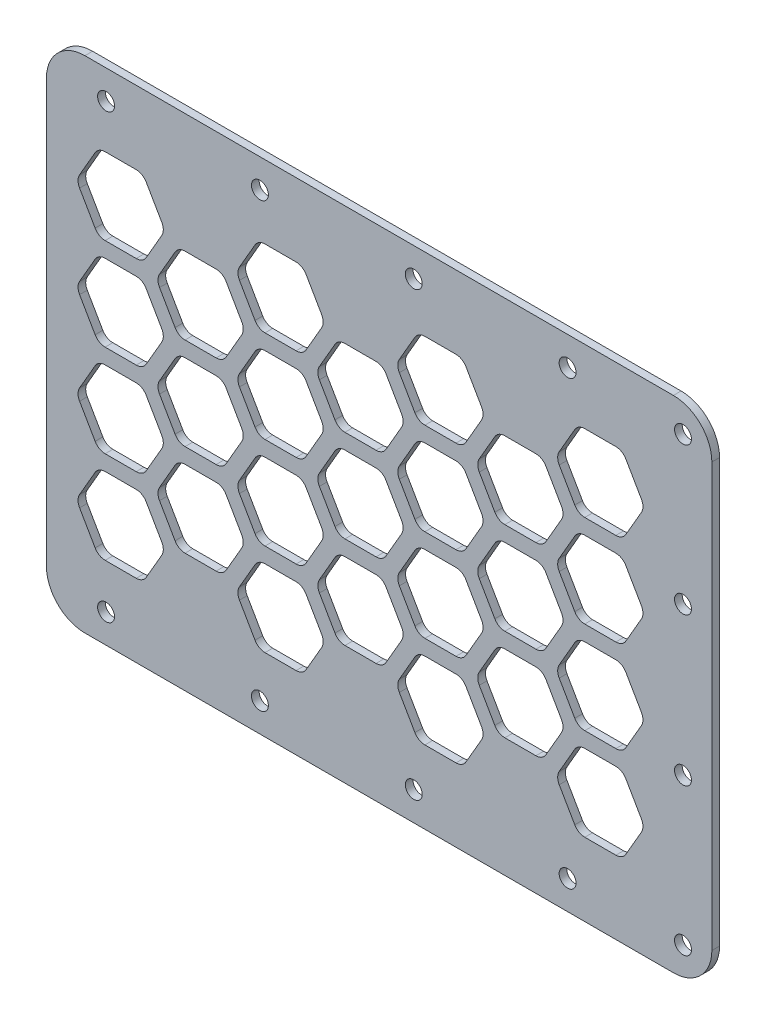
from build123d import *

# Parameters (mm, degrees)
SKETCH_1_W          = 346
SKETCH_1_H          = 130
EXTRUDE_1_DEPTH     = 2
SKETCH_2_R          = 2.2
CUT_EXTRUDE_1_DEPTH = 33
CUT_EXTRUDE_2_DEPTH = 33
FILLET_1_R          = 3
CUT_EXTRUDE_3_DEPTH = 33
FILLET_2_R          = 10
CUT_EXTRUDE_START   = -10
SKETCH_5_R          = 2.2
CUT_EXTRUDE_5_DEPTH = 10
FILLET_4_R          = 10


with BuildPart() as part:
    # 草图1 → 凸台-拉伸1 (new body)
    with BuildSketch(Plane.XY):
        with Locations((173, -65)):
            Rectangle(SKETCH_1_W, SKETCH_1_H)
    extrude(amount=EXTRUDE_1_DEPTH)

    # 草图2 → 切除-拉伸1 (cut)
    with BuildSketch(Plane.XY.offset(2)):
        with Locations((7.502240022, -45.75)):
            Circle(SKETCH_2_R)
        with Locations((7.502240022, -84.25)):
            Circle(SKETCH_2_R)
        with Locations((7.502240022, -122.5)):
            Circle(SKETCH_2_R)
        with Locations((37.502240022, -122.5)):
            Circle(SKETCH_2_R)
        with Locations((77.502240022, -122.5)):
            Circle(SKETCH_2_R)
        with Locations((117.502240022, -122.5)):
            Circle(SKETCH_2_R)
        with Locations((117.502240022, -7.5)):
            Circle(SKETCH_2_R)
        with Locations((77.502240022, -7.5)):
            Circle(SKETCH_2_R)
        with Locations((37.502240022, -7.5)):
            Circle(SKETCH_2_R)
        with Locations((7.502240022, -7.5)):
            Circle(SKETCH_2_R)
        with Locations((308.497759978, -122.5)):
            Circle(SKETCH_2_R)
        with Locations((268.497759978, -122.5)):
            Circle(SKETCH_2_R)
        with Locations((228.497759978, -122.5)):
            Circle(SKETCH_2_R)
        with Locations((228.497759978, -7.5)):
            Circle(SKETCH_2_R)
        with Locations((268.497759978, -7.5)):
            Circle(SKETCH_2_R)
        with Locations((308.497759978, -7.5)):
            Circle(SKETCH_2_R)
        with Locations((338.497759978, -7.5)):
            Circle(SKETCH_2_R)
        with Locations((338.497759978, -45.75)):
            Circle(SKETCH_2_R)
        with Locations((338.497759978, -84.25)):
            Circle(SKETCH_2_R)
        with Locations((338.497759978, -122.5)):
            Circle(SKETCH_2_R)
    extrude(amount=-CUT_EXTRUDE_1_DEPTH, mode=Mode.SUBTRACT)

    # 草图3 → 切除-拉伸2 (cut)
    with BuildSketch(Plane.XY.offset(2)):
        with BuildLine():
            Line((97.993357168, -49.5), (102.900834456, -41))
            Line((102.900834456, -41), (97.127331764, -31))
            Line((97.127331764, -31), (85.580326381, -31))
            Line((85.580326381, -31), (80.672849092, -39.5))
            ThreePointArc((80.672849092, -39.5), (80.270925304, -41), (80.672849092, -42.5))
            Line((80.672849092, -42.5), (85.580326381, -51))
            Line((85.580326381, -51), (95.395280957, -51))
            ThreePointArc((95.395280957, -51), (96.895280957, -50.598076211), (97.993357168, -49.5))
        make_face()
        with BuildLine():
            ThreePointArc((39.68097998, -30.5), (40.082903769, -29), (39.68097998, -27.5))
            Line((39.68097998, -27.5), (34.773502692, -19))
            Line((34.773502692, -19), (24.958548116, -19))
            ThreePointArc((24.958548116, -19), (23.458548116, -19.401923789), (22.360471904, -20.5))
            Line((22.360471904, -20.5), (18.31902002, -27.5))
            ThreePointArc((18.31902002, -27.5), (17.917096231, -29), (18.31902002, -30.5))
            Line((18.31902002, -30.5), (22.360471904, -37.5))
            ThreePointArc((22.360471904, -37.5), (23.458548116, -38.598076211), (24.958548116, -39))
            Line((24.958548116, -39), (33.041451884, -39))
            ThreePointArc((33.041451884, -39), (34.541451884, -38.598076211), (35.639528096, -37.5))
            Line((35.639528096, -37.5), (39.68097998, -30.5))
        make_face()
        with BuildLine():
            ThreePointArc((39.68097998, -54.5), (40.082903769, -53), (39.68097998, -51.5))
            Line((39.68097998, -51.5), (35.639528096, -44.5))
            ThreePointArc((35.639528096, -44.5), (34.541451884, -43.401923789), (33.041451884, -43))
            Line((33.041451884, -43), (24.958548116, -43))
            ThreePointArc((24.958548116, -43), (23.458548116, -43.401923789), (22.360471904, -44.5))
            Line((22.360471904, -44.5), (18.31902002, -51.5))
            ThreePointArc((18.31902002, -51.5), (17.917096231, -53), (18.31902002, -54.5))
            Line((18.31902002, -54.5), (22.360471904, -61.5))
            ThreePointArc((22.360471904, -61.5), (23.458548116, -62.598076211), (24.958548116, -63))
            Line((24.958548116, -63), (33.041451884, -63))
            ThreePointArc((33.041451884, -63), (34.541451884, -62.598076211), (35.639528096, -61.5))
            Line((35.639528096, -61.5), (39.68097998, -54.5))
        make_face()
        with BuildLine():
            ThreePointArc((60.465589671, -42.5), (60.867513459, -41), (60.465589671, -39.5))
            Line((60.465589671, -39.5), (56.424137787, -32.5))
            ThreePointArc((56.424137787, -32.5), (55.326061575, -31.401923789), (53.826061575, -31))
            Line((53.826061575, -31), (45.743157806, -31))
            ThreePointArc((45.743157806, -31), (44.243157806, -31.401923789), (43.145081595, -32.5))
            Line((43.145081595, -32.5), (39.103629711, -39.5))
            ThreePointArc((39.103629711, -39.5), (38.701705922, -41), (39.103629711, -42.5))
            Line((39.103629711, -42.5), (43.145081595, -49.5))
            ThreePointArc((43.145081595, -49.5), (44.243157806, -50.598076211), (45.743157806, -51))
            Line((45.743157806, -51), (53.826061575, -51))
            ThreePointArc((53.826061575, -51), (55.326061575, -50.598076211), (56.424137787, -49.5))
            Line((56.424137787, -49.5), (60.465589671, -42.5))
        make_face()
        with BuildLine():
            ThreePointArc((81.250199362, -30.5), (81.65212315, -29), (81.250199362, -27.5))
            Line((81.250199362, -27.5), (77.208747477, -20.5))
            ThreePointArc((77.208747477, -20.5), (76.110671266, -19.401923789), (74.610671266, -19))
            Line((74.610671266, -19), (66.527767497, -19))
            ThreePointArc((66.527767497, -19), (65.027767497, -19.401923789), (63.929691286, -20.5))
            Line((63.929691286, -20.5), (59.888239402, -27.5))
            ThreePointArc((59.888239402, -27.5), (59.486315613, -29), (59.888239402, -30.5))
            Line((59.888239402, -30.5), (63.929691286, -37.5))
            ThreePointArc((63.929691286, -37.5), (65.027767497, -38.598076211), (66.527767497, -39))
            Line((66.527767497, -39), (74.610671266, -39))
            ThreePointArc((74.610671266, -39), (76.110671266, -38.598076211), (77.208747477, -37.5))
            Line((77.208747477, -37.5), (81.250199362, -30.5))
        make_face()
        with BuildLine():
            ThreePointArc((81.250199362, -54.5), (81.65212315, -53), (81.250199362, -51.5))
            Line((81.250199362, -51.5), (77.208747477, -44.5))
            ThreePointArc((77.208747477, -44.5), (76.110671266, -43.401923789), (74.610671266, -43))
            Line((74.610671266, -43), (66.527767497, -43))
            ThreePointArc((66.527767497, -43), (65.027767497, -43.401923789), (63.929691286, -44.5))
            Line((63.929691286, -44.5), (59.888239402, -51.5))
            ThreePointArc((59.888239402, -51.5), (59.486315613, -53), (59.888239402, -54.5))
            Line((59.888239402, -54.5), (63.929691286, -61.5))
            ThreePointArc((63.929691286, -61.5), (65.027767497, -62.598076211), (66.527767497, -63))
            Line((66.527767497, -63), (74.610671266, -63))
            ThreePointArc((74.610671266, -63), (76.110671266, -62.598076211), (77.208747477, -61.5))
            Line((77.208747477, -61.5), (81.250199362, -54.5))
        make_face()
        with BuildLine():
            ThreePointArc((122.819418743, -30.5), (123.221342532, -29), (122.819418743, -27.5))
            Line((122.819418743, -27.5), (118.777966859, -20.5))
            ThreePointArc((118.777966859, -20.5), (117.679890648, -19.401923789), (116.179890648, -19))
            Line((116.179890648, -19), (108.096986879, -19))
            ThreePointArc((108.096986879, -19), (106.596986879, -19.401923789), (105.498910668, -20.5))
            Line((105.498910668, -20.5), (101.457458783, -27.5))
            ThreePointArc((101.457458783, -27.5), (101.055534995, -29), (101.457458783, -30.5))
            Line((101.457458783, -30.5), (105.498910668, -37.5))
            ThreePointArc((105.498910668, -37.5), (106.596986879, -38.598076211), (108.096986879, -39))
            Line((108.096986879, -39), (116.179890648, -39))
            ThreePointArc((116.179890648, -39), (117.679890648, -38.598076211), (118.777966859, -37.5))
            Line((118.777966859, -37.5), (122.819418743, -30.5))
        make_face()
        with BuildLine():
            ThreePointArc((122.819418743, -54.5), (123.221342532, -53), (122.819418743, -51.5))
            Line((122.819418743, -51.5), (118.777966859, -44.5))
            ThreePointArc((118.777966859, -44.5), (117.679890648, -43.401923789), (116.179890648, -43))
            Line((116.179890648, -43), (108.096986879, -43))
            ThreePointArc((108.096986879, -43), (106.596986879, -43.401923789), (105.498910668, -44.5))
            Line((105.498910668, -44.5), (101.457458783, -51.5))
            ThreePointArc((101.457458783, -51.5), (101.055534995, -53), (101.457458783, -54.5))
            Line((101.457458783, -54.5), (105.498910668, -61.5))
            ThreePointArc((105.498910668, -61.5), (106.596986879, -62.598076211), (108.096986879, -63))
            Line((108.096986879, -63), (116.179890648, -63))
            ThreePointArc((116.179890648, -63), (117.679890648, -62.598076211), (118.777966859, -61.5))
            Line((118.777966859, -61.5), (122.819418743, -54.5))
        make_face()
        with BuildLine():
            Line((138.696551146, -51), (144.470053838, -41))
            Line((144.470053838, -41), (139.56257655, -32.5))
            ThreePointArc((139.56257655, -32.5), (138.464500338, -31.401923789), (136.964500338, -31))
            Line((136.964500338, -31), (127.149545762, -31))
            Line((127.149545762, -31), (121.37604307, -41))
            Line((121.37604307, -41), (126.283520358, -49.5))
            ThreePointArc((126.283520358, -49.5), (127.38159657, -50.598076211), (128.88159657, -51))
            Line((128.88159657, -51), (138.696551146, -51))
        make_face()
        with BuildLine():
            ThreePointArc((164.388638125, -30.5), (164.790561914, -29), (164.388638125, -27.5))
            Line((164.388638125, -27.5), (160.347186241, -20.5))
            ThreePointArc((160.347186241, -20.5), (159.249110029, -19.401923789), (157.749110029, -19))
            Line((157.749110029, -19), (149.666206261, -19))
            ThreePointArc((149.666206261, -19), (148.166206261, -19.401923789), (147.068130049, -20.5))
            Line((147.068130049, -20.5), (143.026678165, -27.5))
            ThreePointArc((143.026678165, -27.5), (142.624754376, -29), (143.026678165, -30.5))
            Line((143.026678165, -30.5), (147.068130049, -37.5))
            ThreePointArc((147.068130049, -37.5), (148.166206261, -38.598076211), (149.666206261, -39))
            Line((149.666206261, -39), (157.749110029, -39))
            ThreePointArc((157.749110029, -39), (159.249110029, -38.598076211), (160.347186241, -37.5))
            Line((160.347186241, -37.5), (164.388638125, -30.5))
        make_face()
        with BuildLine():
            ThreePointArc((164.388638125, -54.5), (164.790561914, -53), (164.388638125, -51.5))
            Line((164.388638125, -51.5), (160.347186241, -44.5))
            ThreePointArc((160.347186241, -44.5), (159.249110029, -43.401923789), (157.749110029, -43))
            Line((157.749110029, -43), (149.666206261, -43))
            ThreePointArc((149.666206261, -43), (148.166206261, -43.401923789), (147.068130049, -44.5))
            Line((147.068130049, -44.5), (143.026678165, -51.5))
            ThreePointArc((143.026678165, -51.5), (142.624754376, -53), (143.026678165, -54.5))
            Line((143.026678165, -54.5), (147.068130049, -61.5))
            ThreePointArc((147.068130049, -61.5), (148.166206261, -62.598076211), (149.666206261, -63))
            Line((149.666206261, -63), (157.749110029, -63))
            ThreePointArc((157.749110029, -63), (159.249110029, -62.598076211), (160.347186241, -61.5))
            Line((160.347186241, -61.5), (164.388638125, -54.5))
        make_face()
        with BuildLine():
            Line((181.611361875, -54.5), (185.652813759, -61.5))
            ThreePointArc((185.652813759, -61.5), (186.750889971, -62.598076211), (188.250889971, -63))
            Line((188.250889971, -63), (196.333793739, -63))
            ThreePointArc((196.333793739, -63), (197.833793739, -62.598076211), (198.931869951, -61.5))
            Line((198.931869951, -61.5), (202.973321835, -54.5))
            ThreePointArc((202.973321835, -54.5), (203.375245624, -53), (202.973321835, -51.5))
            Line((202.973321835, -51.5), (198.931869951, -44.5))
            ThreePointArc((198.931869951, -44.5), (197.833793739, -43.401923789), (196.333793739, -43))
            Line((196.333793739, -43), (188.250889971, -43))
            ThreePointArc((188.250889971, -43), (186.750889971, -43.401923789), (185.652813759, -44.5))
            Line((185.652813759, -44.5), (181.611361875, -51.5))
            ThreePointArc((181.611361875, -51.5), (181.209438086, -53), (181.611361875, -54.5))
        make_face()
        with BuildLine():
            Line((181.611361875, -30.5), (185.652813759, -37.5))
            ThreePointArc((185.652813759, -37.5), (186.750889971, -38.598076211), (188.250889971, -39))
            Line((188.250889971, -39), (196.333793739, -39))
            ThreePointArc((196.333793739, -39), (197.833793739, -38.598076211), (198.931869951, -37.5))
            Line((198.931869951, -37.5), (202.973321835, -30.5))
            ThreePointArc((202.973321835, -30.5), (203.375245624, -29), (202.973321835, -27.5))
            Line((202.973321835, -27.5), (198.931869951, -20.5))
            ThreePointArc((198.931869951, -20.5), (197.833793739, -19.401923789), (196.333793739, -19))
            Line((196.333793739, -19), (188.250889971, -19))
            ThreePointArc((188.250889971, -19), (186.750889971, -19.401923789), (185.652813759, -20.5))
            Line((185.652813759, -20.5), (181.611361875, -27.5))
            ThreePointArc((181.611361875, -27.5), (181.209438086, -29), (181.611361875, -30.5))
        make_face()
        with BuildLine():
            Line((202.395971566, -42.5), (206.43742345, -49.5))
            ThreePointArc((206.43742345, -49.5), (207.535499662, -50.598076211), (209.035499662, -51))
            Line((209.035499662, -51), (217.11840343, -51))
            ThreePointArc((217.11840343, -51), (218.61840343, -50.598076211), (219.716479642, -49.5))
            Line((219.716479642, -49.5), (223.757931526, -42.5))
            ThreePointArc((223.757931526, -42.5), (224.159855315, -41), (223.757931526, -39.5))
            Line((223.757931526, -39.5), (219.716479642, -32.5))
            ThreePointArc((219.716479642, -32.5), (218.61840343, -31.401923789), (217.11840343, -31))
            Line((217.11840343, -31), (209.035499662, -31))
            ThreePointArc((209.035499662, -31), (207.535499662, -31.401923789), (206.43742345, -32.5))
            Line((206.43742345, -32.5), (202.395971566, -39.5))
            ThreePointArc((202.395971566, -39.5), (201.994047777, -41), (202.395971566, -42.5))
        make_face()
        with BuildLine():
            Line((223.180581257, -54.5), (227.222033141, -61.5))
            ThreePointArc((227.222033141, -61.5), (228.320109352, -62.598076211), (229.820109352, -63))
            Line((229.820109352, -63), (237.903013121, -63))
            ThreePointArc((237.903013121, -63), (239.403013121, -62.598076211), (240.501089332, -61.5))
            Line((240.501089332, -61.5), (244.542541217, -54.5))
            ThreePointArc((244.542541217, -54.5), (244.944465005, -53), (244.542541217, -51.5))
            Line((244.542541217, -51.5), (240.501089332, -44.5))
            ThreePointArc((240.501089332, -44.5), (239.403013121, -43.401923789), (237.903013121, -43))
            Line((237.903013121, -43), (229.820109352, -43))
            ThreePointArc((229.820109352, -43), (228.320109352, -43.401923789), (227.222033141, -44.5))
            Line((227.222033141, -44.5), (223.180581257, -51.5))
            ThreePointArc((223.180581257, -51.5), (222.778657468, -53), (223.180581257, -54.5))
        make_face()
        with BuildLine():
            Line((223.180581257, -30.5), (227.222033141, -37.5))
            ThreePointArc((227.222033141, -37.5), (228.320109352, -38.598076211), (229.820109352, -39))
            Line((229.820109352, -39), (237.903013121, -39))
            ThreePointArc((237.903013121, -39), (239.403013121, -38.598076211), (240.501089332, -37.5))
            Line((240.501089332, -37.5), (244.542541217, -30.5))
            ThreePointArc((244.542541217, -30.5), (244.944465005, -29), (244.542541217, -27.5))
            Line((244.542541217, -27.5), (240.501089332, -20.5))
            ThreePointArc((240.501089332, -20.5), (239.403013121, -19.401923789), (237.903013121, -19))
            Line((237.903013121, -19), (229.820109352, -19))
            ThreePointArc((229.820109352, -19), (228.320109352, -19.401923789), (227.222033141, -20.5))
            Line((227.222033141, -20.5), (223.180581257, -27.5))
            ThreePointArc((223.180581257, -27.5), (222.778657468, -29), (223.180581257, -30.5))
        make_face()
        with BuildLine():
            Line((243.965190948, -42.5), (248.006642832, -49.5))
            ThreePointArc((248.006642832, -49.5), (249.104719043, -50.598076211), (250.604719043, -51))
            Line((250.604719043, -51), (258.687622812, -51))
            ThreePointArc((258.687622812, -51), (260.187622812, -50.598076211), (261.285699023, -49.5))
            Line((261.285699023, -49.5), (265.327150908, -42.5))
            ThreePointArc((265.327150908, -42.5), (265.729074696, -41), (265.327150908, -39.5))
            Line((265.327150908, -39.5), (261.285699023, -32.5))
            ThreePointArc((261.285699023, -32.5), (260.187622812, -31.401923789), (258.687622812, -31))
            Line((258.687622812, -31), (250.604719043, -31))
            ThreePointArc((250.604719043, -31), (249.104719043, -31.401923789), (248.006642832, -32.5))
            Line((248.006642832, -32.5), (243.965190948, -39.5))
            ThreePointArc((243.965190948, -39.5), (243.563267159, -41), (243.965190948, -42.5))
        make_face()
        with BuildLine():
            Line((264.749800638, -30.5), (268.791252523, -37.5))
            ThreePointArc((268.791252523, -37.5), (269.889328734, -38.598076211), (271.389328734, -39))
            Line((271.389328734, -39), (279.472232503, -39))
            ThreePointArc((279.472232503, -39), (280.972232503, -38.598076211), (282.070308714, -37.5))
            Line((282.070308714, -37.5), (286.111760598, -30.5))
            ThreePointArc((286.111760598, -30.5), (286.513684387, -29), (286.111760598, -27.5))
            Line((286.111760598, -27.5), (282.070308714, -20.5))
            ThreePointArc((282.070308714, -20.5), (280.972232503, -19.401923789), (279.472232503, -19))
            Line((279.472232503, -19), (271.389328734, -19))
            ThreePointArc((271.389328734, -19), (269.889328734, -19.401923789), (268.791252523, -20.5))
            Line((268.791252523, -20.5), (264.749800638, -27.5))
            ThreePointArc((264.749800638, -27.5), (264.34787685, -29), (264.749800638, -30.5))
        make_face()
        with BuildLine():
            Line((264.749800638, -54.5), (268.791252523, -61.5))
            ThreePointArc((268.791252523, -61.5), (269.889328734, -62.598076211), (271.389328734, -63))
            Line((271.389328734, -63), (279.472232503, -63))
            ThreePointArc((279.472232503, -63), (280.972232503, -62.598076211), (282.070308714, -61.5))
            Line((282.070308714, -61.5), (286.111760598, -54.5))
            ThreePointArc((286.111760598, -54.5), (286.513684387, -53), (286.111760598, -51.5))
            Line((286.111760598, -51.5), (282.070308714, -44.5))
            ThreePointArc((282.070308714, -44.5), (280.972232503, -43.401923789), (279.472232503, -43))
            Line((279.472232503, -43), (271.389328734, -43))
            ThreePointArc((271.389328734, -43), (269.889328734, -43.401923789), (268.791252523, -44.5))
            Line((268.791252523, -44.5), (264.749800638, -51.5))
            ThreePointArc((264.749800638, -51.5), (264.34787685, -53), (264.749800638, -54.5))
        make_face()
        with BuildLine():
            Line((285.534410329, -42.5), (289.575862213, -49.5))
            ThreePointArc((289.575862213, -49.5), (290.673938425, -50.598076211), (292.173938425, -51))
            Line((292.173938425, -51), (300.256842194, -51))
            ThreePointArc((300.256842194, -51), (301.756842194, -50.598076211), (302.854918405, -49.5))
            Line((302.854918405, -49.5), (306.896370289, -42.5))
            ThreePointArc((306.896370289, -42.5), (307.298294078, -41), (306.896370289, -39.5))
            Line((306.896370289, -39.5), (302.854918405, -32.5))
            ThreePointArc((302.854918405, -32.5), (301.756842194, -31.401923789), (300.256842194, -31))
            Line((300.256842194, -31), (292.173938425, -31))
            ThreePointArc((292.173938425, -31), (290.673938425, -31.401923789), (289.575862213, -32.5))
            Line((289.575862213, -32.5), (285.534410329, -39.5))
            ThreePointArc((285.534410329, -39.5), (285.132486541, -41), (285.534410329, -42.5))
        make_face()
        with BuildLine():
            Line((306.31902002, -54.5), (310.360471904, -61.5))
            ThreePointArc((310.360471904, -61.5), (311.458548116, -62.598076211), (312.958548116, -63))
            Line((312.958548116, -63), (321.041451884, -63))
            ThreePointArc((321.041451884, -63), (322.541451884, -62.598076211), (323.639528096, -61.5))
            Line((323.639528096, -61.5), (327.68097998, -54.5))
            ThreePointArc((327.68097998, -54.5), (328.082903769, -53), (327.68097998, -51.5))
            Line((327.68097998, -51.5), (323.639528096, -44.5))
            ThreePointArc((323.639528096, -44.5), (322.541451884, -43.401923789), (321.041451884, -43))
            Line((321.041451884, -43), (312.958548116, -43))
            ThreePointArc((312.958548116, -43), (311.458548116, -43.401923789), (310.360471904, -44.5))
            Line((310.360471904, -44.5), (306.31902002, -51.5))
            ThreePointArc((306.31902002, -51.5), (305.917096231, -53), (306.31902002, -54.5))
        make_face()
        with BuildLine():
            Line((306.31902002, -30.5), (310.360471904, -37.5))
            ThreePointArc((310.360471904, -37.5), (311.458548116, -38.598076211), (312.958548116, -39))
            Line((312.958548116, -39), (321.041451884, -39))
            ThreePointArc((321.041451884, -39), (322.541451884, -38.598076211), (323.639528096, -37.5))
            Line((323.639528096, -37.5), (327.68097998, -30.5))
            ThreePointArc((327.68097998, -30.5), (328.082903769, -29), (327.68097998, -27.5))
            Line((327.68097998, -27.5), (323.639528096, -20.5))
            ThreePointArc((323.639528096, -20.5), (322.541451884, -19.401923789), (321.041451884, -19))
            Line((321.041451884, -19), (312.958548116, -19))
            ThreePointArc((312.958548116, -19), (311.458548116, -19.401923789), (310.360471904, -20.5))
            Line((310.360471904, -20.5), (306.31902002, -27.5))
            ThreePointArc((306.31902002, -27.5), (305.917096231, -29), (306.31902002, -30.5))
        make_face()
        with BuildLine():
            ThreePointArc((323.639528096, -92.5), (322.541451884, -91.401923789), (321.041451884, -91))
            Line((321.041451884, -91), (312.958548116, -91))
            ThreePointArc((312.958548116, -91), (311.458548116, -91.401923789), (310.360471904, -92.5))
            Line((310.360471904, -92.5), (306.31902002, -99.5))
            ThreePointArc((306.31902002, -99.5), (305.917096231, -101), (306.31902002, -102.5))
            Line((306.31902002, -102.5), (310.360471904, -109.5))
            ThreePointArc((310.360471904, -109.5), (311.458548116, -110.598076211), (312.958548116, -111))
            Line((312.958548116, -111), (321.041451884, -111))
            ThreePointArc((321.041451884, -111), (322.541451884, -110.598076211), (323.639528096, -109.5))
            Line((323.639528096, -109.5), (327.68097998, -102.5))
            ThreePointArc((327.68097998, -102.5), (328.082903769, -101), (327.68097998, -99.5))
            Line((327.68097998, -99.5), (323.639528096, -92.5))
        make_face()
        with BuildLine():
            ThreePointArc((323.639528096, -68.5), (322.541451884, -67.401923789), (321.041451884, -67))
            Line((321.041451884, -67), (312.958548116, -67))
            ThreePointArc((312.958548116, -67), (311.458548116, -67.401923789), (310.360471904, -68.5))
            Line((310.360471904, -68.5), (306.31902002, -75.5))
            ThreePointArc((306.31902002, -75.5), (305.917096231, -77), (306.31902002, -78.5))
            Line((306.31902002, -78.5), (310.360471904, -85.5))
            ThreePointArc((310.360471904, -85.5), (311.458548116, -86.598076211), (312.958548116, -87))
            Line((312.958548116, -87), (321.041451884, -87))
            ThreePointArc((321.041451884, -87), (322.541451884, -86.598076211), (323.639528096, -85.5))
            Line((323.639528096, -85.5), (327.68097998, -78.5))
            ThreePointArc((327.68097998, -78.5), (328.082903769, -77), (327.68097998, -75.5))
            Line((327.68097998, -75.5), (323.639528096, -68.5))
        make_face()
        with BuildLine():
            ThreePointArc((302.854918405, -80.5), (301.756842194, -79.401923789), (300.256842194, -79))
            Line((300.256842194, -79), (292.173938425, -79))
            ThreePointArc((292.173938425, -79), (290.673938425, -79.401923789), (289.575862213, -80.5))
            Line((289.575862213, -80.5), (285.534410329, -87.5))
            ThreePointArc((285.534410329, -87.5), (285.132486541, -89), (285.534410329, -90.5))
            Line((285.534410329, -90.5), (289.575862213, -97.5))
            ThreePointArc((289.575862213, -97.5), (290.673938425, -98.598076211), (292.173938425, -99))
            Line((292.173938425, -99), (300.256842194, -99))
            ThreePointArc((300.256842194, -99), (301.756842194, -98.598076211), (302.854918405, -97.5))
            Line((302.854918405, -97.5), (306.896370289, -90.5))
            ThreePointArc((306.896370289, -90.5), (307.298294078, -89), (306.896370289, -87.5))
            Line((306.896370289, -87.5), (302.854918405, -80.5))
        make_face()
        with BuildLine():
            ThreePointArc((282.070308714, -92.5), (280.972232503, -91.401923789), (279.472232503, -91))
            Line((279.472232503, -91), (271.389328734, -91))
            ThreePointArc((271.389328734, -91), (269.889328734, -91.401923789), (268.791252523, -92.5))
            Line((268.791252523, -92.5), (264.749800638, -99.5))
            ThreePointArc((264.749800638, -99.5), (264.34787685, -101), (264.749800638, -102.5))
            Line((264.749800638, -102.5), (268.791252523, -109.5))
            ThreePointArc((268.791252523, -109.5), (269.889328734, -110.598076211), (271.389328734, -111))
            Line((271.389328734, -111), (279.472232503, -111))
            ThreePointArc((279.472232503, -111), (280.972232503, -110.598076211), (282.070308714, -109.5))
            Line((282.070308714, -109.5), (286.111760598, -102.5))
            ThreePointArc((286.111760598, -102.5), (286.513684387, -101), (286.111760598, -99.5))
            Line((286.111760598, -99.5), (282.070308714, -92.5))
        make_face()
        with BuildLine():
            ThreePointArc((282.070308714, -68.5), (280.972232503, -67.401923789), (279.472232503, -67))
            Line((279.472232503, -67), (271.389328734, -67))
            ThreePointArc((271.389328734, -67), (269.889328734, -67.401923789), (268.791252523, -68.5))
            Line((268.791252523, -68.5), (264.749800638, -75.5))
            ThreePointArc((264.749800638, -75.5), (264.34787685, -77), (264.749800638, -78.5))
            Line((264.749800638, -78.5), (268.791252523, -85.5))
            ThreePointArc((268.791252523, -85.5), (269.889328734, -86.598076211), (271.389328734, -87))
            Line((271.389328734, -87), (279.472232503, -87))
            ThreePointArc((279.472232503, -87), (280.972232503, -86.598076211), (282.070308714, -85.5))
            Line((282.070308714, -85.5), (286.111760598, -78.5))
            ThreePointArc((286.111760598, -78.5), (286.513684387, -77), (286.111760598, -75.5))
            Line((286.111760598, -75.5), (282.070308714, -68.5))
        make_face()
        with BuildLine():
            ThreePointArc((261.285699023, -80.5), (260.187622812, -79.401923789), (258.687622812, -79))
            Line((258.687622812, -79), (250.604719043, -79))
            ThreePointArc((250.604719043, -79), (249.104719043, -79.401923789), (248.006642832, -80.5))
            Line((248.006642832, -80.5), (243.965190948, -87.5))
            ThreePointArc((243.965190948, -87.5), (243.563267159, -89), (243.965190948, -90.5))
            Line((243.965190948, -90.5), (248.006642832, -97.5))
            ThreePointArc((248.006642832, -97.5), (249.104719043, -98.598076211), (250.604719043, -99))
            Line((250.604719043, -99), (258.687622812, -99))
            ThreePointArc((258.687622812, -99), (260.187622812, -98.598076211), (261.285699023, -97.5))
            Line((261.285699023, -97.5), (265.327150908, -90.5))
            ThreePointArc((265.327150908, -90.5), (265.729074696, -89), (265.327150908, -87.5))
            Line((265.327150908, -87.5), (261.285699023, -80.5))
        make_face()
        with BuildLine():
            ThreePointArc((240.501089332, -68.5), (239.403013121, -67.401923789), (237.903013121, -67))
            Line((237.903013121, -67), (229.820109352, -67))
            ThreePointArc((229.820109352, -67), (228.320109352, -67.401923789), (227.222033141, -68.5))
            Line((227.222033141, -68.5), (223.180581257, -75.5))
            ThreePointArc((223.180581257, -75.5), (222.778657468, -77), (223.180581257, -78.5))
            Line((223.180581257, -78.5), (227.222033141, -85.5))
            ThreePointArc((227.222033141, -85.5), (228.320109352, -86.598076211), (229.820109352, -87))
            Line((229.820109352, -87), (237.903013121, -87))
            ThreePointArc((237.903013121, -87), (239.403013121, -86.598076211), (240.501089332, -85.5))
            Line((240.501089332, -85.5), (244.542541217, -78.5))
            ThreePointArc((244.542541217, -78.5), (244.944465005, -77), (244.542541217, -75.5))
            Line((244.542541217, -75.5), (240.501089332, -68.5))
        make_face()
        with BuildLine():
            ThreePointArc((240.501089332, -92.5), (239.403013121, -91.401923789), (237.903013121, -91))
            Line((237.903013121, -91), (229.820109352, -91))
            ThreePointArc((229.820109352, -91), (228.320109352, -91.401923789), (227.222033141, -92.5))
            Line((227.222033141, -92.5), (223.180581257, -99.5))
            ThreePointArc((223.180581257, -99.5), (222.778657468, -101), (223.180581257, -102.5))
            Line((223.180581257, -102.5), (227.222033141, -109.5))
            ThreePointArc((227.222033141, -109.5), (228.320109352, -110.598076211), (229.820109352, -111))
            Line((229.820109352, -111), (237.903013121, -111))
            ThreePointArc((237.903013121, -111), (239.403013121, -110.598076211), (240.501089332, -109.5))
            Line((240.501089332, -109.5), (244.542541217, -102.5))
            ThreePointArc((244.542541217, -102.5), (244.944465005, -101), (244.542541217, -99.5))
            Line((244.542541217, -99.5), (240.501089332, -92.5))
        make_face()
        with BuildLine():
            ThreePointArc((219.716479642, -80.5), (218.61840343, -79.401923789), (217.11840343, -79))
            Line((217.11840343, -79), (209.035499662, -79))
            ThreePointArc((209.035499662, -79), (207.535499662, -79.401923789), (206.43742345, -80.5))
            Line((206.43742345, -80.5), (202.395971566, -87.5))
            ThreePointArc((202.395971566, -87.5), (201.994047777, -89), (202.395971566, -90.5))
            Line((202.395971566, -90.5), (206.43742345, -97.5))
            ThreePointArc((206.43742345, -97.5), (207.535499662, -98.598076211), (209.035499662, -99))
            Line((209.035499662, -99), (217.11840343, -99))
            ThreePointArc((217.11840343, -99), (218.61840343, -98.598076211), (219.716479642, -97.5))
            Line((219.716479642, -97.5), (223.757931526, -90.5))
            ThreePointArc((223.757931526, -90.5), (224.159855315, -89), (223.757931526, -87.5))
            Line((223.757931526, -87.5), (219.716479642, -80.5))
        make_face()
        with BuildLine():
            ThreePointArc((198.931869951, -68.5), (197.833793739, -67.401923789), (196.333793739, -67))
            Line((196.333793739, -67), (188.250889971, -67))
            ThreePointArc((188.250889971, -67), (186.750889971, -67.401923789), (185.652813759, -68.5))
            Line((185.652813759, -68.5), (181.611361875, -75.5))
            ThreePointArc((181.611361875, -75.5), (181.209438086, -77), (181.611361875, -78.5))
            Line((181.611361875, -78.5), (185.652813759, -85.5))
            ThreePointArc((185.652813759, -85.5), (186.750889971, -86.598076211), (188.250889971, -87))
            Line((188.250889971, -87), (196.333793739, -87))
            ThreePointArc((196.333793739, -87), (197.833793739, -86.598076211), (198.931869951, -85.5))
            Line((198.931869951, -85.5), (202.973321835, -78.5))
            ThreePointArc((202.973321835, -78.5), (203.375245624, -77), (202.973321835, -75.5))
            Line((202.973321835, -75.5), (198.931869951, -68.5))
        make_face()
        with BuildLine():
            ThreePointArc((198.931869951, -92.5), (197.833793739, -91.401923789), (196.333793739, -91))
            Line((196.333793739, -91), (188.250889971, -91))
            ThreePointArc((188.250889971, -91), (186.750889971, -91.401923789), (185.652813759, -92.5))
            Line((185.652813759, -92.5), (181.611361875, -99.5))
            ThreePointArc((181.611361875, -99.5), (181.209438086, -101), (181.611361875, -102.5))
            Line((181.611361875, -102.5), (185.652813759, -109.5))
            ThreePointArc((185.652813759, -109.5), (186.750889971, -110.598076211), (188.250889971, -111))
            Line((188.250889971, -111), (196.333793739, -111))
            ThreePointArc((196.333793739, -111), (197.833793739, -110.598076211), (198.931869951, -109.5))
            Line((198.931869951, -109.5), (202.973321835, -102.5))
            ThreePointArc((202.973321835, -102.5), (203.375245624, -101), (202.973321835, -99.5))
            Line((202.973321835, -99.5), (198.931869951, -92.5))
        make_face()
        with BuildLine():
            Line((164.388638125, -75.5), (160.347186241, -68.5))
            ThreePointArc((160.347186241, -68.5), (159.249110029, -67.401923789), (157.749110029, -67))
            Line((157.749110029, -67), (149.666206261, -67))
            ThreePointArc((149.666206261, -67), (148.166206261, -67.401923789), (147.068130049, -68.5))
            Line((147.068130049, -68.5), (143.026678165, -75.5))
            ThreePointArc((143.026678165, -75.5), (142.624754376, -77), (143.026678165, -78.5))
            Line((143.026678165, -78.5), (147.068130049, -85.5))
            ThreePointArc((147.068130049, -85.5), (148.166206261, -86.598076211), (149.666206261, -87))
            Line((149.666206261, -87), (157.749110029, -87))
            ThreePointArc((157.749110029, -87), (159.249110029, -86.598076211), (160.347186241, -85.5))
            Line((160.347186241, -85.5), (164.388638125, -78.5))
            ThreePointArc((164.388638125, -78.5), (164.790561914, -77), (164.388638125, -75.5))
        make_face()
        with BuildLine():
            Line((164.388638125, -99.5), (160.347186241, -92.5))
            ThreePointArc((160.347186241, -92.5), (159.249110029, -91.401923789), (157.749110029, -91))
            Line((157.749110029, -91), (149.666206261, -91))
            ThreePointArc((149.666206261, -91), (148.166206261, -91.401923789), (147.068130049, -92.5))
            Line((147.068130049, -92.5), (143.026678165, -99.5))
            ThreePointArc((143.026678165, -99.5), (142.624754376, -101), (143.026678165, -102.5))
            Line((143.026678165, -102.5), (147.068130049, -109.5))
            ThreePointArc((147.068130049, -109.5), (148.166206261, -110.598076211), (149.666206261, -111))
            Line((149.666206261, -111), (157.749110029, -111))
            ThreePointArc((157.749110029, -111), (159.249110029, -110.598076211), (160.347186241, -109.5))
            Line((160.347186241, -109.5), (164.388638125, -102.5))
            ThreePointArc((164.388638125, -102.5), (164.790561914, -101), (164.388638125, -99.5))
        make_face()
        with BuildLine():
            Line((144.470053838, -89), (138.696551146, -79))
            Line((138.696551146, -79), (128.88159657, -79))
            ThreePointArc((128.88159657, -79), (127.38159657, -79.401923789), (126.283520358, -80.5))
            Line((126.283520358, -80.5), (121.37604307, -89))
            Line((121.37604307, -89), (127.149545762, -99))
            Line((127.149545762, -99), (136.964500338, -99))
            ThreePointArc((136.964500338, -99), (138.464500338, -98.598076211), (139.56257655, -97.5))
            Line((139.56257655, -97.5), (144.470053838, -89))
        make_face()
        with BuildLine():
            Line((122.819418743, -75.5), (118.777966859, -68.5))
            ThreePointArc((118.777966859, -68.5), (117.679890648, -67.401923789), (116.179890648, -67))
            Line((116.179890648, -67), (108.096986879, -67))
            ThreePointArc((108.096986879, -67), (106.596986879, -67.401923789), (105.498910668, -68.5))
            Line((105.498910668, -68.5), (101.457458783, -75.5))
            ThreePointArc((101.457458783, -75.5), (101.055534995, -77), (101.457458783, -78.5))
            Line((101.457458783, -78.5), (105.498910668, -85.5))
            ThreePointArc((105.498910668, -85.5), (106.596986879, -86.598076211), (108.096986879, -87))
            Line((108.096986879, -87), (116.179890648, -87))
            ThreePointArc((116.179890648, -87), (117.679890648, -86.598076211), (118.777966859, -85.5))
            Line((118.777966859, -85.5), (122.819418743, -78.5))
            ThreePointArc((122.819418743, -78.5), (123.221342532, -77), (122.819418743, -75.5))
        make_face()
        with BuildLine():
            Line((122.819418743, -99.5), (118.777966859, -92.5))
            ThreePointArc((118.777966859, -92.5), (117.679890648, -91.401923789), (116.179890648, -91))
            Line((116.179890648, -91), (108.096986879, -91))
            ThreePointArc((108.096986879, -91), (106.596986879, -91.401923789), (105.498910668, -92.5))
            Line((105.498910668, -92.5), (101.457458783, -99.5))
            ThreePointArc((101.457458783, -99.5), (101.055534995, -101), (101.457458783, -102.5))
            Line((101.457458783, -102.5), (105.498910668, -109.5))
            ThreePointArc((105.498910668, -109.5), (106.596986879, -110.598076211), (108.096986879, -111))
            Line((108.096986879, -111), (116.179890648, -111))
            ThreePointArc((116.179890648, -111), (117.679890648, -110.598076211), (118.777966859, -109.5))
            Line((118.777966859, -109.5), (122.819418743, -102.5))
            ThreePointArc((122.819418743, -102.5), (123.221342532, -101), (122.819418743, -99.5))
        make_face()
        with BuildLine():
            Line((102.900834456, -89), (97.993357168, -80.5))
            ThreePointArc((97.993357168, -80.5), (96.895280957, -79.401923789), (95.395280957, -79))
            Line((95.395280957, -79), (85.580326381, -79))
            Line((85.580326381, -79), (80.672849092, -87.5))
            ThreePointArc((80.672849092, -87.5), (80.270925304, -89), (80.672849092, -90.5))
            Line((80.672849092, -90.5), (85.580326381, -99))
            Line((85.580326381, -99), (97.127331764, -99))
            Line((97.127331764, -99), (102.900834456, -89))
        make_face()
        with BuildLine():
            Line((81.250199362, -99.5), (77.208747477, -92.5))
            ThreePointArc((77.208747477, -92.5), (76.110671266, -91.401923789), (74.610671266, -91))
            Line((74.610671266, -91), (66.527767497, -91))
            ThreePointArc((66.527767497, -91), (65.027767497, -91.401923789), (63.929691286, -92.5))
            Line((63.929691286, -92.5), (59.888239402, -99.5))
            ThreePointArc((59.888239402, -99.5), (59.486315613, -101), (59.888239402, -102.5))
            Line((59.888239402, -102.5), (63.929691286, -109.5))
            ThreePointArc((63.929691286, -109.5), (65.027767497, -110.598076211), (66.527767497, -111))
            Line((66.527767497, -111), (74.610671266, -111))
            ThreePointArc((74.610671266, -111), (76.110671266, -110.598076211), (77.208747477, -109.5))
            Line((77.208747477, -109.5), (81.250199362, -102.5))
            ThreePointArc((81.250199362, -102.5), (81.65212315, -101), (81.250199362, -99.5))
        make_face()
        with BuildLine():
            Line((81.250199362, -75.5), (77.208747477, -68.5))
            ThreePointArc((77.208747477, -68.5), (76.110671266, -67.401923789), (74.610671266, -67))
            Line((74.610671266, -67), (66.527767497, -67))
            ThreePointArc((66.527767497, -67), (65.027767497, -67.401923789), (63.929691286, -68.5))
            Line((63.929691286, -68.5), (59.888239402, -75.5))
            ThreePointArc((59.888239402, -75.5), (59.486315613, -77), (59.888239402, -78.5))
            Line((59.888239402, -78.5), (63.929691286, -85.5))
            ThreePointArc((63.929691286, -85.5), (65.027767497, -86.598076211), (66.527767497, -87))
            Line((66.527767497, -87), (74.610671266, -87))
            ThreePointArc((74.610671266, -87), (76.110671266, -86.598076211), (77.208747477, -85.5))
            Line((77.208747477, -85.5), (81.250199362, -78.5))
            ThreePointArc((81.250199362, -78.5), (81.65212315, -77), (81.250199362, -75.5))
        make_face()
        with BuildLine():
            Line((60.465589671, -87.5), (56.424137787, -80.5))
            ThreePointArc((56.424137787, -80.5), (55.326061575, -79.401923789), (53.826061575, -79))
            Line((53.826061575, -79), (45.743157806, -79))
            ThreePointArc((45.743157806, -79), (44.243157806, -79.401923789), (43.145081595, -80.5))
            Line((43.145081595, -80.5), (39.103629711, -87.5))
            ThreePointArc((39.103629711, -87.5), (38.701705922, -89), (39.103629711, -90.5))
            Line((39.103629711, -90.5), (43.145081595, -97.5))
            ThreePointArc((43.145081595, -97.5), (44.243157806, -98.598076211), (45.743157806, -99))
            Line((45.743157806, -99), (53.826061575, -99))
            ThreePointArc((53.826061575, -99), (55.326061575, -98.598076211), (56.424137787, -97.5))
            Line((56.424137787, -97.5), (60.465589671, -90.5))
            ThreePointArc((60.465589671, -90.5), (60.867513459, -89), (60.465589671, -87.5))
        make_face()
        with BuildLine():
            Line((39.68097998, -75.5), (35.639528096, -68.5))
            ThreePointArc((35.639528096, -68.5), (34.541451884, -67.401923789), (33.041451884, -67))
            Line((33.041451884, -67), (24.958548116, -67))
            ThreePointArc((24.958548116, -67), (23.458548116, -67.401923789), (22.360471904, -68.5))
            Line((22.360471904, -68.5), (18.31902002, -75.5))
            ThreePointArc((18.31902002, -75.5), (17.917096231, -77), (18.31902002, -78.5))
            Line((18.31902002, -78.5), (22.360471904, -85.5))
            ThreePointArc((22.360471904, -85.5), (23.458548116, -86.598076211), (24.958548116, -87))
            Line((24.958548116, -87), (33.041451884, -87))
            ThreePointArc((33.041451884, -87), (34.541451884, -86.598076211), (35.639528096, -85.5))
            Line((35.639528096, -85.5), (39.68097998, -78.5))
            ThreePointArc((39.68097998, -78.5), (40.082903769, -77), (39.68097998, -75.5))
        make_face()
        with BuildLine():
            Line((39.68097998, -99.5), (35.639528096, -92.5))
            ThreePointArc((35.639528096, -92.5), (34.541451884, -91.401923789), (33.041451884, -91))
            Line((33.041451884, -91), (24.958548116, -91))
            ThreePointArc((24.958548116, -91), (23.458548116, -91.401923789), (22.360471904, -92.5))
            Line((22.360471904, -92.5), (18.31902002, -99.5))
            ThreePointArc((18.31902002, -99.5), (17.917096231, -101), (18.31902002, -102.5))
            Line((18.31902002, -102.5), (22.360471904, -109.5))
            ThreePointArc((22.360471904, -109.5), (23.458548116, -110.598076211), (24.958548116, -111))
            Line((24.958548116, -111), (34.773502692, -111))
            Line((34.773502692, -111), (39.68097998, -102.5))
            ThreePointArc((39.68097998, -102.5), (40.082903769, -101), (39.68097998, -99.5))
        make_face()
    extrude(amount=-CUT_EXTRUDE_2_DEPTH, mode=Mode.SUBTRACT)

    # 圆角1
    fillet_1_edges = [part.edges().sort_by_distance(p)[0] for p in [
        (144.470053838, -89, 1),
        (138.696551146, -79, 1),
        (127.149545762, -99, 1),
        (138.696551146, -51, 1),
        (144.470053838, -41, 1),
        (121.37604307, -41, 1),
        (127.149545762, -31, 1),
        (97.127331764, -31, 1),
        (85.580326381, -31, 1),
        (34.773502692, -19, 1),
        (85.580326381, -99, 1),
        (97.127331764, -99, 1),
        (34.773502692, -111, 1),
    ]]
    fillet(fillet_1_edges, radius=FILLET_1_R)

    # 草图4 → 切除-拉伸3 (cut)
    with BuildSketch(Plane.XY.offset(2)):
        with BuildLine():
            ThreePointArc((102.034809052, -66.5), (102.436732841, -65), (102.034809052, -63.5))
            Line((102.034809052, -63.5), (97.993357168, -56.5))
            ThreePointArc((97.993357168, -56.5), (96.895280957, -55.401923789), (95.395280957, -55))
            Line((95.395280957, -55), (87.312377188, -55))
            ThreePointArc((87.312377188, -55), (85.812377188, -55.401923789), (84.714300977, -56.5))
            Line((84.714300977, -56.5), (80.672849092, -63.5))
            ThreePointArc((80.672849092, -63.5), (80.270925304, -65), (80.672849092, -66.5))
            Line((80.672849092, -66.5), (84.714300977, -73.5))
            ThreePointArc((84.714300977, -73.5), (85.812377188, -74.598076211), (87.312377188, -75))
            Line((87.312377188, -75), (95.395280957, -75))
            ThreePointArc((95.395280957, -75), (96.895280957, -74.598076211), (97.993357168, -73.5))
            Line((97.993357168, -73.5), (102.034809052, -66.5))
        make_face()
        with BuildLine():
            ThreePointArc((60.465589671, -66.5), (60.867513459, -65), (60.465589671, -63.5))
            Line((60.465589671, -63.5), (56.424137787, -56.5))
            ThreePointArc((56.424137787, -56.5), (55.326061575, -55.401923789), (53.826061575, -55))
            Line((53.826061575, -55), (45.743157806, -55))
            ThreePointArc((45.743157806, -55), (44.243157806, -55.401923789), (43.145081595, -56.5))
            Line((43.145081595, -56.5), (39.103629711, -63.5))
            ThreePointArc((39.103629711, -63.5), (38.701705922, -65), (39.103629711, -66.5))
            Line((39.103629711, -66.5), (43.145081595, -73.5))
            ThreePointArc((43.145081595, -73.5), (44.243157806, -74.598076211), (45.743157806, -75))
            Line((45.743157806, -75), (53.826061575, -75))
            ThreePointArc((53.826061575, -75), (55.326061575, -74.598076211), (56.424137787, -73.5))
            Line((56.424137787, -73.5), (60.465589671, -66.5))
        make_face()
        with BuildLine():
            ThreePointArc((143.604028434, -66.5), (144.005952223, -65), (143.604028434, -63.5))
            Line((143.604028434, -63.5), (139.56257655, -56.5))
            ThreePointArc((139.56257655, -56.5), (138.464500338, -55.401923789), (136.964500338, -55))
            Line((136.964500338, -55), (128.88159657, -55))
            ThreePointArc((128.88159657, -55), (127.38159657, -55.401923789), (126.283520358, -56.5))
            Line((126.283520358, -56.5), (122.242068474, -63.5))
            ThreePointArc((122.242068474, -63.5), (121.840144685, -65), (122.242068474, -66.5))
            Line((122.242068474, -66.5), (126.283520358, -73.5))
            ThreePointArc((126.283520358, -73.5), (127.38159657, -74.598076211), (128.88159657, -75))
            Line((128.88159657, -75), (136.964500338, -75))
            ThreePointArc((136.964500338, -75), (138.464500338, -74.598076211), (139.56257655, -73.5))
            Line((139.56257655, -73.5), (143.604028434, -66.5))
        make_face()
        with BuildLine():
            Line((202.395971566, -66.5), (206.43742345, -73.5))
            ThreePointArc((206.43742345, -73.5), (207.535499662, -74.598076211), (209.035499662, -75))
            Line((209.035499662, -75), (217.11840343, -75))
            ThreePointArc((217.11840343, -75), (218.61840343, -74.598076211), (219.716479642, -73.5))
            Line((219.716479642, -73.5), (223.757931526, -66.5))
            ThreePointArc((223.757931526, -66.5), (224.159855315, -65), (223.757931526, -63.5))
            Line((223.757931526, -63.5), (219.716479642, -56.5))
            ThreePointArc((219.716479642, -56.5), (218.61840343, -55.401923789), (217.11840343, -55))
            Line((217.11840343, -55), (209.035499662, -55))
            ThreePointArc((209.035499662, -55), (207.535499662, -55.401923789), (206.43742345, -56.5))
            Line((206.43742345, -56.5), (202.395971566, -63.5))
            ThreePointArc((202.395971566, -63.5), (201.994047777, -65), (202.395971566, -66.5))
        make_face()
        with BuildLine():
            Line((243.965190948, -66.5), (248.006642832, -73.5))
            ThreePointArc((248.006642832, -73.5), (249.104719043, -74.598076211), (250.604719043, -75))
            Line((250.604719043, -75), (258.687622812, -75))
            ThreePointArc((258.687622812, -75), (260.187622812, -74.598076211), (261.285699023, -73.5))
            Line((261.285699023, -73.5), (265.327150908, -66.5))
            ThreePointArc((265.327150908, -66.5), (265.729074696, -65), (265.327150908, -63.5))
            Line((265.327150908, -63.5), (261.285699023, -56.5))
            ThreePointArc((261.285699023, -56.5), (260.187622812, -55.401923789), (258.687622812, -55))
            Line((258.687622812, -55), (250.604719043, -55))
            ThreePointArc((250.604719043, -55), (249.104719043, -55.401923789), (248.006642832, -56.5))
            Line((248.006642832, -56.5), (243.965190948, -63.5))
            ThreePointArc((243.965190948, -63.5), (243.563267159, -65), (243.965190948, -66.5))
        make_face()
        with BuildLine():
            Line((285.534410329, -66.5), (289.575862213, -73.5))
            ThreePointArc((289.575862213, -73.5), (290.673938425, -74.598076211), (292.173938425, -75))
            Line((292.173938425, -75), (300.256842194, -75))
            ThreePointArc((300.256842194, -75), (301.756842194, -74.598076211), (302.854918405, -73.5))
            Line((302.854918405, -73.5), (306.896370289, -66.5))
            ThreePointArc((306.896370289, -66.5), (307.298294078, -65), (306.896370289, -63.5))
            Line((306.896370289, -63.5), (302.854918405, -56.5))
            ThreePointArc((302.854918405, -56.5), (301.756842194, -55.401923789), (300.256842194, -55))
            Line((300.256842194, -55), (292.173938425, -55))
            ThreePointArc((292.173938425, -55), (290.673938425, -55.401923789), (289.575862213, -56.5))
            Line((289.575862213, -56.5), (285.534410329, -63.5))
            ThreePointArc((285.534410329, -63.5), (285.132486541, -65), (285.534410329, -66.5))
        make_face()
    extrude(amount=-CUT_EXTRUDE_3_DEPTH, mode=Mode.SUBTRACT)

    # 圆角2
    fillet_2_edges = [part.edges().sort_by_distance(p)[0] for p in [
        (0, 0, 1),
        (0, -130, 1),
        (346, -130, 1),
        (346, 0, 1),
    ]]
    fillet(fillet_2_edges, radius=FILLET_2_R)

    # 草图5 → 切除-拉伸5 (cut)
    # profile 1 of 3: a face of its own
    with BuildSketch(Plane(origin=(0, 0, 0), x_dir=(-1, 0, 0), z_dir=(0, 0, -1)).offset(CUT_EXTRUDE_START)):
        with BuildLine():
            Line((-173, 0), (-173, -130))
            Line((-173, -130), (-10, -130))
            ThreePointArc((-10, -130), (-2.928932188, -127.071067812), (0, -120))
            Line((0, -120), (0, -10))
            ThreePointArc((0, -10), (-2.928932188, -2.928932188), (-10, 0))
            Line((-10, 0), (-173, 0))
        make_face()
        with Locations((-117.502240022, -7.5)):
            Circle(SKETCH_5_R, mode=Mode.SUBTRACT)
        with Locations((-77.502240022, -7.5)):
            Circle(SKETCH_5_R, mode=Mode.SUBTRACT)
        with Locations((-37.502240022, -7.5)):
            Circle(SKETCH_5_R, mode=Mode.SUBTRACT)
        with Locations((-7.502240022, -7.5)):
            Circle(SKETCH_5_R, mode=Mode.SUBTRACT)
        with Locations((-7.502240022, -45.75)):
            Circle(SKETCH_5_R, mode=Mode.SUBTRACT)
        with Locations((-7.502240022, -84.25)):
            Circle(SKETCH_5_R, mode=Mode.SUBTRACT)
        with Locations((-7.502240022, -122.5)):
            Circle(SKETCH_5_R, mode=Mode.SUBTRACT)
        with Locations((-37.502240022, -122.5)):
            Circle(SKETCH_5_R, mode=Mode.SUBTRACT)
        with Locations((-77.502240022, -122.5)):
            Circle(SKETCH_5_R, mode=Mode.SUBTRACT)
        with Locations((-117.502240022, -122.5)):
            Circle(SKETCH_5_R, mode=Mode.SUBTRACT)
    # profile 2 of 3: a face of its own
    with BuildSketch(Plane(origin=(0, 0, 0), x_dir=(-1, 0, 0), z_dir=(0, 0, -1)).offset(CUT_EXTRUDE_START)):
        with Locations((-188.497759978, -122.5)):
            Circle(SKETCH_5_R)
    # profile 3 of 3: a face of its own
    with BuildSketch(Plane(origin=(0, 0, 0), x_dir=(-1, 0, 0), z_dir=(0, 0, -1)).offset(CUT_EXTRUDE_START)):
        with Locations((-188.497759978, -7.5)):
            Circle(SKETCH_5_R)
    extrude(amount=CUT_EXTRUDE_5_DEPTH, mode=Mode.SUBTRACT)

    # 圆角4
    fillet_4_edges = [part.edges().sort_by_distance(p)[0] for p in [
        (173, -130, 1),
        (173, 0, 1),
    ]]
    fillet(fillet_4_edges, radius=FILLET_4_R)


solid = part.part
